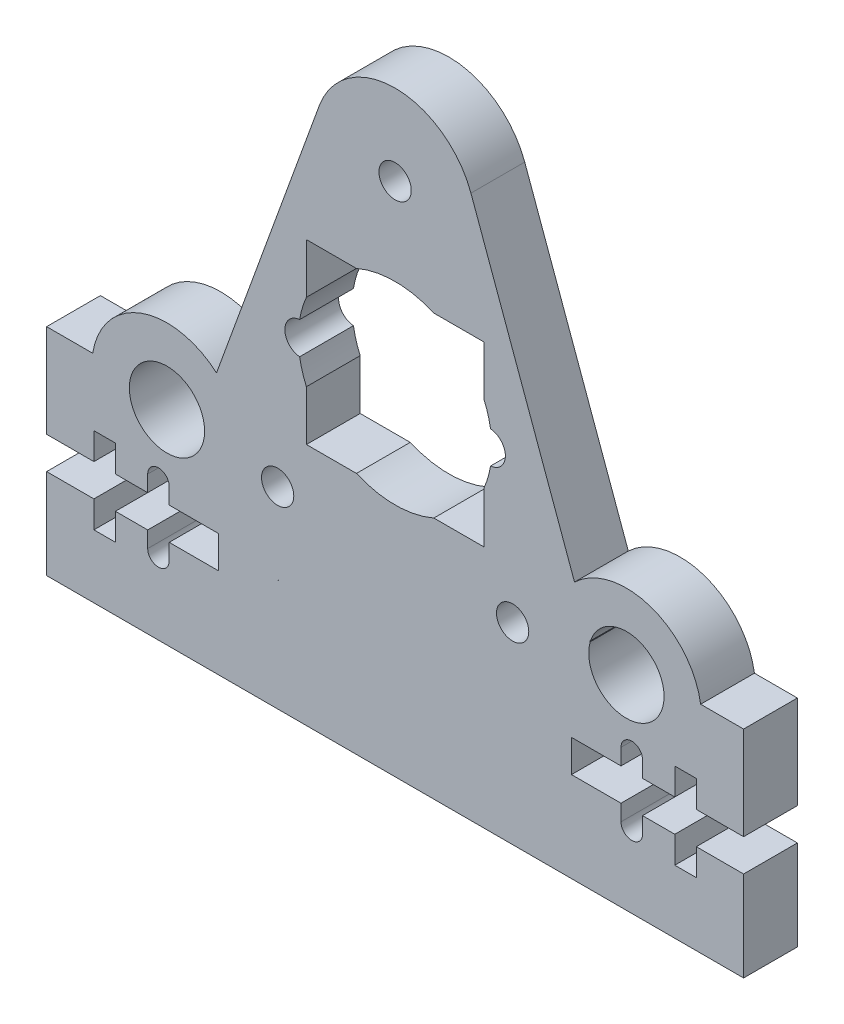
from build123d import *

# Parameters (mm, degrees)
SKETCH1_R           = 3.5
SKETCH1_R_2         = 1.5
BOSS_EXTRUDE1_DEPTH = 5
SKETCH2_W           = 2
SKETCH2_H           = 7.986219489
SKETCH2_W_2         = 16
SKETCH2_H_2         = 3
CUT_EXTRUDE3_DEPTH  = 10


with BuildPart() as part:
    # Sketch1 → Boss-Extrude1 (new body)
    with BuildSketch(Plane.XY):
        with BuildLine():
            Line((16.678684739, -6.865443356), (7.048954955, 19.63254949))
            ThreePointArc((7.048954955, 19.63254949), (-0.000574134, 24.570863688), (-7.049347073, 19.631470247))
            Line((-7.049347073, 19.631470247), (-16.60248251, -6.668301445))
            ThreePointArc((-16.60248251, -6.668301445), (-23.589225287, -5.352701736), (-28.111762071, -10.838322782))
            Line((-28.111762071, -10.838322782), (-32.396038203, -10.838322782))
            Line((-32.396038203, -10.838322782), (-32.396038203, -30.881690835))
            Line((-32.396038203, -30.881690835), (32.396038203, -30.881690835))
            Line((32.396038203, -30.881690835), (32.396038203, -10.838322782))
            Line((32.396038203, -10.838322782), (28.403544795, -10.838322782))
            ThreePointArc((28.403544795, -10.838322782), (23.74315896, -5.304380506), (16.678684739, -6.865443356))
        make_face()
        with Locations((-21.209007359, -11.922115015)):
            Circle(SKETCH1_R, mode=Mode.SUBTRACT)
        with BuildLine():
            Line((3.592595297, 8.251863973), (8.245757774, 8.254276772))
            Line((8.245757774, 8.254276772), (8.248133809, 3.67201473))
            ThreePointArc((8.248133809, 3.67201473), (8.625435504, 2.640272663), (8.874223719, 1.570248043))
            ThreePointArc((8.874223719, 1.570248043), (10.249998622, 0.076178628), (8.875773895, -1.41931674))
            ThreePointArc((8.875773895, -1.41931674), (8.62809549, -2.489598792), (8.251863973, -3.521731588))
            Line((8.251863973, -3.521731588), (8.254313497, -8.24572101))
            Line((8.254313497, -8.24572101), (3.601151021, -8.248133809))
            ThreePointArc((3.601151021, -8.248133809), (0.004666758, -8.99999879), (-3.592595297, -8.251863973))
            Line((-3.592595297, -8.251863973), (-8.245721029, -8.254276752))
            Line((-8.245721029, -8.254276752), (-8.248133809, -3.601151021))
            ThreePointArc((-8.248133809, -3.601151021), (-8.625435504, -2.569408953), (-8.874223719, -1.499384334))
            ThreePointArc((-8.874223719, -1.499384334), (-10.249998622, -0.005314919), (-8.875773895, 1.49018045))
            ThreePointArc((-8.875773895, 1.49018045), (-8.62809549, 2.560462502), (-8.251863973, 3.592595297))
            Line((-8.251863973, 3.592595297), (-8.254276752, 8.245721029))
            Line((-8.254276752, 8.245721029), (-3.601151021, 8.248133809))
            ThreePointArc((-3.601151021, 8.248133809), (-0.004666758, 8.99999879), (3.592595297, 8.251863973))
        make_face(mode=Mode.SUBTRACT)
        with Locations((0, 17.070863709)):
            Circle(SKETCH1_R_2, mode=Mode.SUBTRACT)
        with BuildLine():
            ThreePointArc((18.172818569, -10.838322782), (24.845541744, -12.952957548), (18.140100673, -10.944481806))
            ThreePointArc((18.140100673, -10.944481806), (18.124834746, -10.891345307), (18.109177542, -10.838322782))
            Line((18.109177542, -10.838322782), (18.172818569, -10.838322782))
        make_face(mode=Mode.SUBTRACT)
        with BuildLine():
            Line((-11.086043951, -20.488849886), (-10.753093745, -20.488849886))
            ThreePointArc((-10.753093745, -20.488849886), (-10.919568848, -20.490697711), (-11.086043951, -20.488849886))
        make_face(mode=Mode.SUBTRACT)
        with Locations((10.924107384, -12.988849886)):
            Circle(SKETCH1_R_2, mode=Mode.SUBTRACT)
        with Locations((-10.919568848, -12.990697711)):
            Circle(SKETCH1_R_2, mode=Mode.SUBTRACT)
    extrude(amount=BOSS_EXTRUDE1_DEPTH)

    # Sketch2 → Cut-Extrude3 (cut)
    with BuildSketch(Plane.XY.offset(5)):
        with Locations((27.000036745, -21.006890237)):
            Rectangle(SKETCH2_W, SKETCH2_H)
        with Locations((24.396038203, -21.006890237)):
            Rectangle(SKETCH2_W_2, SKETCH2_H_2)
        with BuildLine():
            Line((23.000036745, -18.006890237), (23.000036745, -24.006890237))
            ThreePointArc((23.000036745, -24.006890237), (22.000036745, -25.006890237), (21.000036745, -24.006890237))
            Line((21.000036745, -24.006890237), (21.000036745, -18.006890237))
            ThreePointArc((21.000036745, -18.006890237), (22.000036745, -17.006890237), (23.000036745, -18.006890237))
        make_face()
    cut_extrude3 = extrude(amount=-CUT_EXTRUDE3_DEPTH, mode=Mode.SUBTRACT)

    # Mirror1: Cut-Extrude3 across plane
    add(cut_extrude3.mirror(Plane(origin=(0, 0, 0), x_dir=(0, 0, 1), z_dir=(1, 0, 0))), mode=Mode.SUBTRACT)


solid = part.part
